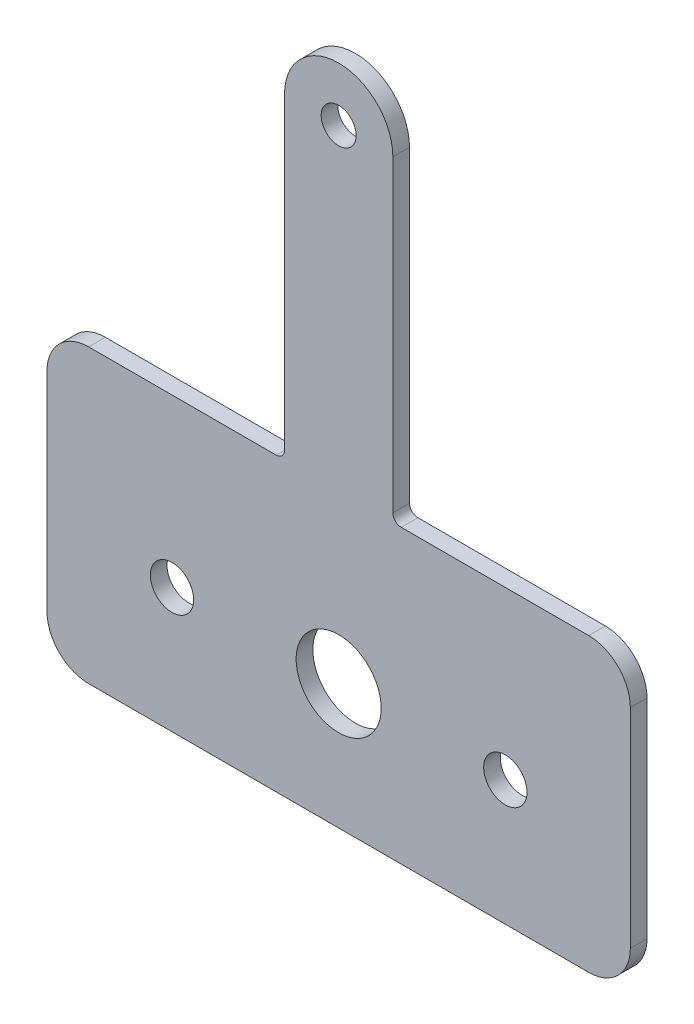
from build123d import *

# Parameters (mm, degrees)
SKETCH1_R             = 2.6
SKETCH1_R_2           = 5.1
BASE_FLANGE1_DEPTH    = 2
M5X0_8_TAPPED_HOLE1_D = 4.2


# Sheet-metal steps are written as plain solids
with BuildPart() as part:
    # Sketch1 → Base-Flange1 (new body)
    with BuildSketch(Plane.XY):
        with BuildLine():
            Line((-35, 15), (-35, -10))
            ThreePointArc((-35, -10), (-33.535533906, -13.535533906), (-30, -15))
            Line((-30, -15), (30, -15))
            ThreePointArc((30, -15), (33.535533906, -13.535533906), (35, -10))
            Line((35, -10), (35, 15))
            ThreePointArc((35, 15), (33.535533906, 18.535533906), (30, 20))
            Line((30, 20), (7.5, 20))
            ThreePointArc((7.5, 20), (6.792893219, 20.292893219), (6.5, 21))
            Line((6.5, 21), (6.5, 58))
            ThreePointArc((6.5, 58), (0, 64.5), (-6.5, 58))
            Line((-6.5, 58), (-6.5, 21))
            ThreePointArc((-6.5, 21), (-6.792893219, 20.292893219), (-7.5, 20))
            Line((-7.5, 20), (-30, 20))
            ThreePointArc((-30, 20), (-33.535533906, 18.535533906), (-35, 15))
        make_face()
        with Locations((-20, 0)):
            Circle(SKETCH1_R, mode=Mode.SUBTRACT)
        Circle(SKETCH1_R_2, mode=Mode.SUBTRACT)
        with Locations((20, 0)):
            Circle(SKETCH1_R, mode=Mode.SUBTRACT)
    extrude(amount=-BASE_FLANGE1_DEPTH)

    # M5x0.8 Tapped Hole1 (through all)
    with Locations(Plane.XY):
        with Locations((0, 58)):
            Hole(M5X0_8_TAPPED_HOLE1_D / 2)


solid = part.part
